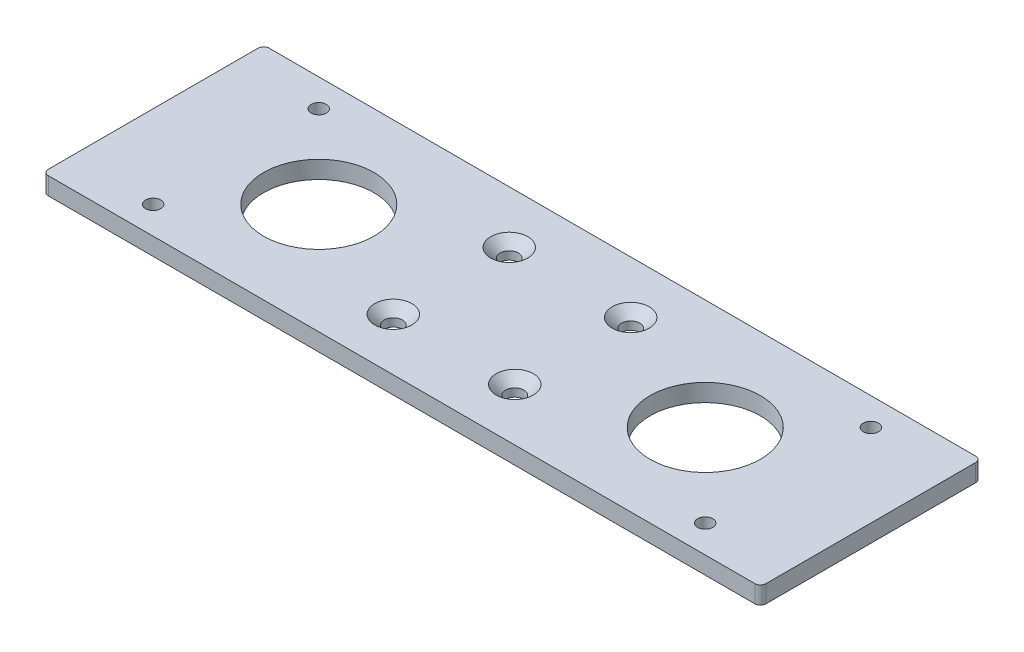
from build123d import *

# Parameters (mm, degrees)
CROQUIS1_W                                   = 260
CROQUIS1_H                                   = 80
BRIDA_BASE1_DEPTH                            = 6.35
REDONDEO1_R                                  = 2
TALADRO_DE_MARGEN_PARA_M51_D                 = 5.5
REFRENTADO_PARA_TORNILLO_TAP_N_CON_C_2_COUNT = 2
REFRENTADO_PARA_TORNILLO_TAP_N_CON_C_2_PITCH = 44
REFRENTADO_PARA_TORNILLO_TAP_N_CON_C_3_COUNT = 2
REFRENTADO_PARA_TORNILLO_TAP_N_CON_C_3_PITCH = 60.827625303
REFRENTADO_PARA_TORNILLO_TAP_N_CON_C_4_COUNT = 2
REFRENTADO_PARA_TORNILLO_TAP_N_CON_C_4_PITCH = 42
CROQUIS11_R                                  = 20
CORTAR_EXTRUIR1_DEPTH                        = 10


# Sheet-metal steps are written as plain solids
with BuildPart() as part:
    # Croquis1 → Brida base1 (new body)
    with BuildSketch(Plane(origin=(0, 0, 0), x_dir=(1, 0, 0), z_dir=(0, 1, 0))):
        with Locations((-19.777777778, -5.555555556)):
            Rectangle(CROQUIS1_W, CROQUIS1_H)
    extrude(amount=-BRIDA_BASE1_DEPTH)

    # Redondeo1
    redondeo1_edges = [part.edges().sort_by_distance(p)[0] for p in [
        (-149.777777778, -3.175, -34.444444444),
        (110.222222222, -3.175, -34.444444444),
        (110.222222222, -3.175, 45.555555556),
        (-149.777777778, -3.175, 45.555555556),
    ]]
    fillet(redondeo1_edges, radius=REDONDEO1_R)

    # Taladro de margen para M51 (through all)
    with Locations(Plane(origin=(0, 0, 0), x_dir=(1, 0, 0), z_dir=(0, 1, 0))):
        with Locations((-119.777777778, 24.444444444), (-119.777777778, -35.555555556), (80.222222222, -35.555555556), (80.222222222, 24.444444444)):
            Hole(TALADRO_DE_MARGEN_PARA_M51_D / 2)

    # Croquis9 → Refrentado para tornillo tapón con cabeza plana de clavija de M61 (revolve, cut)
    with BuildSketch(Plane(origin=(-41.777777778, 0, -15.444444444), x_dir=(0, 0, 1), z_dir=(1, 0, 0))):
        Polygon((0, 0), (0, 6.35), (3.3, 6.35), (3.3, 3.42), (6.72, 0), align=None)
    refrentado_para_tornillo_tap_n_con_cabez = revolve(axis=Axis((-41.777777778, 6.35, -15.444444444), (0, -1, 0)), mode=Mode.SUBTRACT)

    # Refrentado para tornillo tap_n con c 2: Refrentado para tornillo tapón con cabeza plana de clavija de M61 ×2
    with Locations(*[(i * REFRENTADO_PARA_TORNILLO_TAP_N_CON_C_2_PITCH, 0, 0) for i in range(1, REFRENTADO_PARA_TORNILLO_TAP_N_CON_C_2_COUNT)]):
        add(refrentado_para_tornillo_tap_n_con_cabez, mode=Mode.SUBTRACT)

    # Refrentado para tornillo tap_n con c 3: Refrentado para tornillo tapón con cabeza plana de clavija de M61 ×2
    with Locations(*[Vector(0.7233555441435721, 0, 0.6904757466825007) * (i * REFRENTADO_PARA_TORNILLO_TAP_N_CON_C_3_PITCH) for i in range(1, REFRENTADO_PARA_TORNILLO_TAP_N_CON_C_3_COUNT)]):
        add(refrentado_para_tornillo_tap_n_con_cabez, mode=Mode.SUBTRACT)

    # Refrentado para tornillo tap_n con c 4: Refrentado para tornillo tapón con cabeza plana de clavija de M61 ×2
    with Locations(*[(0, 0, i * REFRENTADO_PARA_TORNILLO_TAP_N_CON_C_4_PITCH) for i in range(1, REFRENTADO_PARA_TORNILLO_TAP_N_CON_C_4_COUNT)]):
        add(refrentado_para_tornillo_tap_n_con_cabez, mode=Mode.SUBTRACT)

    # Croquis11 → Cortar-Extruir1 (cut)
    with BuildSketch(Plane(origin=(0, 0, 0), x_dir=(1, 0, 0), z_dir=(0, 1, 0))):
        with Locations(Location((-89.777777778, -5.555555556, 0), (0, 0, 270))):
            Circle(CROQUIS11_R)
        with Locations(Location((50.222222222, -5.555555556, 0), (0, 0, 270))):
            Circle(CROQUIS11_R)
    extrude(amount=-CORTAR_EXTRUIR1_DEPTH, mode=Mode.SUBTRACT)


solid = part.part
